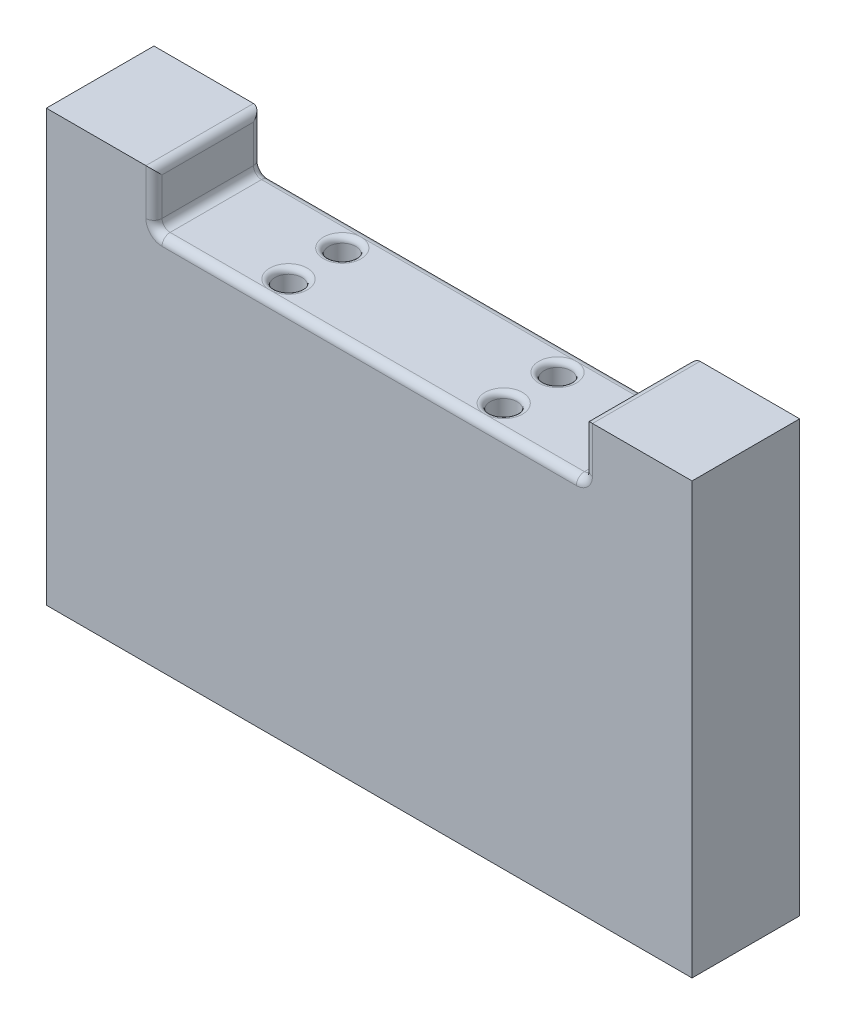
from build123d import *

# Parameters (mm, degrees)
SKETCH2_W           = 120
SKETCH2_H           = 80
BOSS_EXTRUDE1_DEPTH = 20
SKETCH3_W           = 80
SKETCH3_H           = 40
CUT_EXTRUDE1_DEPTH  = 10
SKETCH5_R           = 2.5
CUT_EXTRUDE3_DEPTH  = 95.339811321
FILLET5_R           = 1
FILLET6_R           = 1.5


with BuildPart() as part:
    # Sketch2 → Boss-Extrude1 (new body)
    with BuildSketch(Plane.XY):
        Rectangle(SKETCH2_W, SKETCH2_H)
    extrude(amount=BOSS_EXTRUDE1_DEPTH)

    # Sketch3 → Cut-Extrude1 (cut)
    with BuildSketch(Plane(origin=(0, 40, 0), x_dir=(1, 0, 0), z_dir=(0, 1, 0))):
        Rectangle(SKETCH3_W, SKETCH3_H)
    extrude(amount=-CUT_EXTRUDE1_DEPTH, mode=Mode.SUBTRACT)

    # Sketch5 → Cut-Extrude3 (cut, through all)
    with BuildSketch(Plane(origin=(0, 30, 0), x_dir=(1, 0, 0), z_dir=(0, 1, 0))):
        with Locations(Location((-20, -5, 0), (0, 0, 270))):
            Circle(SKETCH5_R)
        with Locations(Location((-20, -15, 0), (0, 0, 270))):
            Circle(SKETCH5_R)
        with Locations(Location((20, -5, 0), (0, 0, 270))):
            Circle(SKETCH5_R)
        with Locations(Location((20, -15, 0), (0, 0, 270))):
            Circle(SKETCH5_R)
    extrude(amount=-CUT_EXTRUDE3_DEPTH, mode=Mode.SUBTRACT)

    # Fillet5
    fillet5_edges = [part.edges().sort_by_distance(p)[0] for p in [
        (-20, -40, 12.5),
        (-20, 30, 12.5),
        (20, -40, 2.5),
        (20, 30, 2.5),
        (20, -40, 12.5),
        (20, 30, 12.5),
        (-20, -40, 2.5),
        (-20, 30, 2.5),
    ]]
    fillet(fillet5_edges, radius=FILLET5_R)

    # Fillet6
    fillet6_edges = [part.edges().sort_by_distance(p)[0] for p in [
        (0, 30, 0),
        (-40, 35, 0),
        (40, 35, 0),
        (40, 30, 10),
        (0, 30, 20),
        (40, 35, 20),
        (-40, 30, 10),
        (-40, 35, 20),
        (-40, 40, 10),
        (40, 40, 10),
    ]]
    fillet(fillet6_edges, radius=FILLET6_R - 0.0001)  # a hair under: the kernel refuses the full size


solid = part.part
